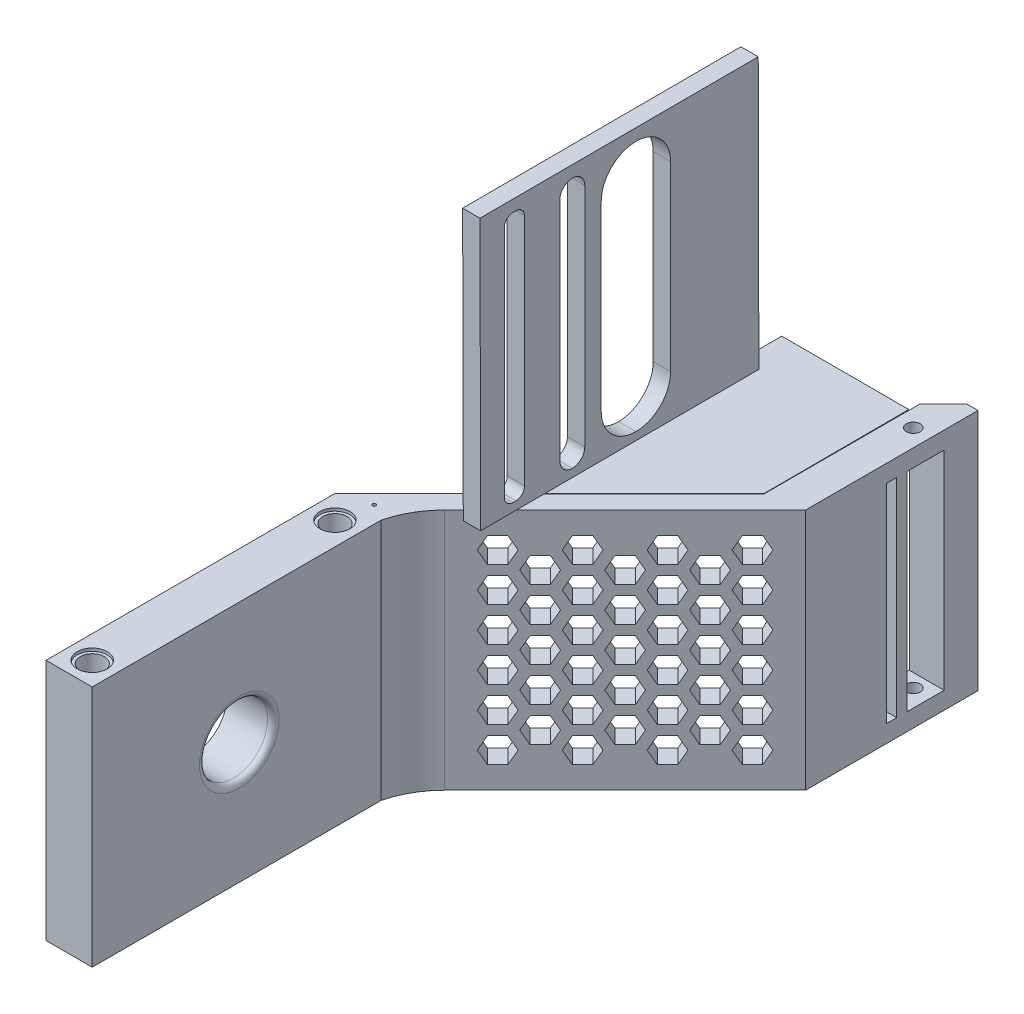
from build123d import *

# Parameters (mm, degrees)
SKETCH1_W            = 25
SKETCH1_H            = 50
SKETCH1_R            = 3.4
BOSS_EXTRUDE1_DEPTH  = 3
SKETCH2_W            = 50
SKETCH2_H            = 3
BOSS_EXTRUDE2_DEPTH  = 8
SKETCH3_W            = 8
SKETCH3_H            = 50
BOSS_EXTRUDE3_DEPTH  = 42
SKETCH4_R            = 2.65
CUT_EXTRUDE1_DEPTH   = 0.5
SKETCH5_R            = 5.888972746
CUT_EXTRUDE2_DEPTH   = 9
FILLET2_R            = 1
SKETCH6_R            = 12.6
BOSS_EXTRUDE4_DEPTH  = 2
FILLET4_R            = 1
SKETCH8_R            = 1.589780168
SKETCH8_R_2          = 1.777428262
CUT_EXTRUDE3_DEPTH   = 10
SKETCH9_W            = 49.021678163
SKETCH9_H            = 20.976854622
CUT_EXTRUDE4_DEPTH   = 68.79439129
SKETCH11_R           = 2.1
CUT_EXTRUDE5_DEPTH   = 59.480168703
SKETCH14_R           = 2.6
CUT_EXTRUDE6_DEPTH   = 0.5
BOSS_EXTRUDE5_DEPTH  = 42
FILLET5_R            = 15
BOSS_EXTRUDE6_DEPTH  = 42
SKETCH17_W           = 48.146702591
SKETCH17_H           = 46.904691646
BOSS_EXTRUDE7_DEPTH  = 3
BOSS_EXTRUDE8_DEPTH  = 2
FILL_START           = -39.593416363
FILL_PATTERN1_DEPTH  = 4.479865946
SKETCH20_W           = 3.5
SKETCH20_H           = 43.48627111
CUT_EXTRUDE7_DEPTH   = 10
FILLET6_R            = 1.5
SKETCH21_W           = 12
SKETCH21_H           = 43.48627111
CUT_EXTRUDE8_DEPTH   = 10
FILLET7_R            = 6
SKETCH23_W           = 4.3
SKETCH23_H           = 43.48627111
CUT_EXTRUDE10_DEPTH  = 10
FILLET8_R            = 2.15
SKETCH27_W           = 7.5
SKETCH27_H           = 36
CUT_EXTRUDE11_DEPTH  = 116.383052707
SKETCH28_R           = 1.2
CUT_EXTRUDE12_DEPTH  = 113.041318123
SKETCH29_W           = 6
SKETCH29_H           = 42
BOSS_EXTRUDE11_DEPTH = 5.87
CHAMFER1_SIZE        = 4
SKETCH30_R           = 0.3
CUT_EXTRUDE13_DEPTH  = 118.2394939
SKETCH31_W           = 1.8
SKETCH31_H           = 36
CUT_EXTRUDE14_DEPTH  = 10


# Read off the part's stored shape, not the designer's step: Fill Pattern1
# Some blends are built 0.0001 mm under size
with BuildPart() as part:
    # Sketch1 → Boss-Extrude1 (new body)
    with BuildSketch(Plane(origin=(0, 0, 0), x_dir=(1, 0, 0), z_dir=(0, 1, 0))):
        with Locations((2.276951673, 11.384758364)):
            Rectangle(SKETCH1_W, SKETCH1_H)
        with Locations(Location((1.276951673, 11.384758364, 0), (0, 0, 270))):
            Circle(SKETCH1_R, mode=Mode.SUBTRACT)
    extrude(amount=BOSS_EXTRUDE1_DEPTH)

    # Sketch2 → Boss-Extrude2 (add)
    with BuildSketch(Plane.ZY.offset(10.223048327)):
        with Locations((-11.384758364, 1.5)):
            Rectangle(SKETCH2_W, SKETCH2_H)
    extrude(amount=BOSS_EXTRUDE2_DEPTH)

    # Sketch3 → Boss-Extrude3 (add)
    with BuildSketch(Plane.XZ):
        with Locations((-14.223048327, -11.384758364)):
            Rectangle(SKETCH3_W, SKETCH3_H)
    extrude(amount=BOSS_EXTRUDE3_DEPTH)

    # Sketch4 → Cut-Extrude1 (cut)
    with BuildSketch(Plane(origin=(0, 3, 0), x_dir=(1, 0, 0), z_dir=(0, 1, 0))):
        with Locations(Location((-14.223048327, 32.384758364, 0), (0, 0, 270))):
            Circle(SKETCH4_R)
        with Locations(Location((-14.223048327, -9.615241636, 0), (0, 0, 270))):
            Circle(SKETCH4_R)
    cut_extrude1 = extrude(amount=-CUT_EXTRUDE1_DEPTH, mode=Mode.SUBTRACT)

    # Mirror1: Cut-Extrude1 across plane
    add(cut_extrude1.mirror(Plane.ZX.offset(-19.5)), mode=Mode.SUBTRACT)

    # Sketch5 → Cut-Extrude2 (cut)
    with BuildSketch(Plane.ZY.offset(18.223048327)):
        with Locations((-11.836279124, -21)):
            Circle(SKETCH5_R)
    extrude(amount=-CUT_EXTRUDE2_DEPTH, mode=Mode.SUBTRACT)

    # Fillet2
    fillet2_edges = [part.edges().sort_by_distance(p)[0] for p in [
        (-10.223048327, -21, -17.72525187),
    ]]
    fillet(fillet2_edges, radius=FILLET2_R)

    # Mirror2: Cut-Extrude1 across plane
    add(cut_extrude1.mirror(Plane.ZY.offset(1.723048327)), mode=Mode.SUBTRACT)

    # Sketch6 → Boss-Extrude4 (add)
    with BuildSketch(Plane(origin=(0, 3, 0), x_dir=(1, 0, 0), z_dir=(0, 1, 0))):
        with BuildLine():
            Line((14.776951673, 5.825082115), (14.776951673, 16.944434614))
            ThreePointArc((14.776951673, 16.944434614), (-13.323048327, 11.384758364), (14.776951673, 5.825082115))
        make_face()
        with Locations(Location((1.276951673, 11.384758364, 0), (0, 0, 270))):
            Circle(SKETCH6_R, mode=Mode.SUBTRACT)
    extrude(amount=BOSS_EXTRUDE4_DEPTH)

    # Fillet4
    # the kernel refuses this fillet: 1 mm, written as the material it takes off along each edge
    with BuildSketch(Plane(origin=(14.776951673, 5, -3.325082115), x_dir=(0, -1, 0), z_dir=(0, 0, -1))) as fillet4_piece_1:
        with BuildLine():
            CenterArc((FILLET4_R, FILLET4_R), FILLET4_R, 180, 90)
            Line((0, FILLET4_R), (0, 0))
            Line((0, 0), (FILLET4_R, 0))
        make_face()
    extrude(amount=16.119352499, mode=Mode.SUBTRACT)

    # Sketch8 → Cut-Extrude3 (cut)
    with BuildSketch(Plane(origin=(0, 3, 0), x_dir=(1, 0, 0), z_dir=(0, 1, 0))):
        with Locations(Location((1.276951673, 19.884758364, 0), (0, 0, 270))):
            Circle(SKETCH8_R)
        with Locations(Location((1.276951673, 2.884758364, 0), (0, 0, 270))):
            Circle(SKETCH8_R_2)
    extrude(amount=-CUT_EXTRUDE3_DEPTH, mode=Mode.SUBTRACT)

    # Sketch9 → Cut-Extrude4 (cut, through all)
    with BuildSketch(Plane.XY.offset(13.615241636)):
        with Locations((-9.733887409, 10.488427311)):
            Rectangle(SKETCH9_W, SKETCH9_H)
    extrude(amount=-CUT_EXTRUDE4_DEPTH, mode=Mode.SUBTRACT)

    # Sketch11 → Cut-Extrude5 (cut, through all)
    with BuildSketch(Plane(origin=(0, 0, 0), x_dir=(1, 0, 0), z_dir=(0, 1, 0))):
        with Locations(Location((-14.223048327, 32.384758364, 0), (0, 0, 270))):
            Circle(SKETCH11_R)
    cut_extrude5 = extrude(amount=-CUT_EXTRUDE5_DEPTH, mode=Mode.SUBTRACT)

    # Mirror3: Cut-Extrude5 across plane
    add(cut_extrude5.mirror(Plane.XY.offset(-11.384758364)), mode=Mode.SUBTRACT)

    # Sketch14 → Cut-Extrude6 (cut)
    with BuildSketch(Plane(origin=(0, 0, 0), x_dir=(1, 0, 0), z_dir=(0, 1, 0))):
        with Locations(Location((-14.223048327, -9.615241636, 0), (0, 0, 270))):
            Circle(SKETCH14_R)
    cut_extrude6 = extrude(amount=-CUT_EXTRUDE6_DEPTH, mode=Mode.SUBTRACT)

    # Mirror4: Cut-Extrude6 across plane
    add(cut_extrude6.mirror(Plane.XY.offset(-11.384758364)), mode=Mode.SUBTRACT)

    # Sketch15 → Boss-Extrude5 (add)
    with BuildSketch(Plane(origin=(0, 0, 0), x_dir=(1, 0, 0), z_dir=(0, 1, 0))):
        Polygon((-18.223048327, 36.384758364), (24.976951673, 79.584758364), (24.976951673, 74.635010896), (-13.273300859, 36.384758364), align=None)
    extrude(amount=-BOSS_EXTRUDE5_DEPTH)

    # Fillet5
    # the kernel refuses this fillet: 15 mm, written as the material it adds along each edge
    with BuildSketch(Plane(origin=(-13.273300859, 0, -36.384758364), x_dir=(1, 0, 0), z_dir=(0, -1, 0))) as fillet5_piece_1:
        with BuildLine():
            CenterArc((17.611399837, 3.601803599), FILLET5_R, 193.893637127, 31.106362873)
            Line((7.004798119, -7.004798119), (0, 0))
            Line((0, 0), (3.050252532, 0))
        make_face()
    extrude(amount=42)

    # Sketch16 → Boss-Extrude6 (add)
    with BuildSketch(Plane(origin=(0, 0, 0), x_dir=(1, 0, 0), z_dir=(0, 1, 0))):
        Polygon((18.976951673, 73.584758364), (18.976951673, 98.584758364), (24.976951673, 98.584758364), (24.976951673, 79.584758364), align=None)
    extrude(amount=-BOSS_EXTRUDE6_DEPTH)



with BuildPart() as body_2:
    # Sketch17 → Boss-Extrude7 (new body)
    with BuildSketch(Plane(origin=(-0.023048327, -88.270826713, 236.630045038), x_dir=(0, 0.002303401717977271, -0.999997347166744), z_dir=(1, 0, 0))):
        with Locations((304.295533146, 111.077940737)):
            Rectangle(SKETCH17_W, SKETCH17_H)
    extrude(amount=-BOSS_EXTRUDE7_DEPTH)


with BuildPart() as part_1:
    add(part.part)

    add(body_2.part)  # Boss-Extrude8 merges body 2
    # Sketch18 → Boss-Extrude8 (add)
    with BuildSketch(Plane(origin=(0, -0.099943314, -0.00023021), x_dir=(1, 0, 0), z_dir=(0, -0.9999973471667442, -0.0023034017179773937))):
        Polygon((-3.023048327, -91.536143969), (-3.023048327, -51.487878646), (18.976951673, -73.487820284), (18.976951673, -98.487753963), (-3.023048327, -98.487753963), align=None)
    extrude(amount=BOSS_EXTRUDE8_DEPTH)

    # Fill Pattern1 outline → Fill Pattern1 (cut)
    with BuildSketch(Plane(origin=(0, 0, 0), x_dir=(0.7071067811865457, 0, -0.7071067811865495), z_dir=(0.7071067811865493, 0, 0.7071067811865458)).offset(FILL_START)):
        Polygon((30.253964255, -6), (31.503964255, -8.165063509), (34.003964255, -8.165063509), (35.253964255, -6), (34.003964255, -3.834936491), (31.503964255, -3.834936491), align=None)
        Polygon((45.842421523, -33), (47.092421523, -35.165063509), (49.592421523, -35.165063509), (50.842421523, -33), (49.592421523, -30.834936491), (47.092421523, -30.834936491), align=None)
        Polygon((40.6462691, -24), (41.8962691, -26.165063509), (44.3962691, -26.165063509), (45.6462691, -24), (44.3962691, -21.834936491), (41.8962691, -21.834936491), align=None)
        Polygon((35.450116678, -15), (36.700116678, -17.165063509), (39.200116678, -17.165063509), (40.450116678, -15), (39.200116678, -12.834936491), (36.700116678, -12.834936491), align=None)
        Polygon((52.288573946, -8.165063509), (54.788573946, -8.165063509), (56.038573946, -6), (54.788573946, -3.834936491), (52.288573946, -3.834936491), (51.038573946, -6), align=None)
        Polygon((41.8962691, -8.165063509), (44.3962691, -8.165063509), (45.6462691, -6), (44.3962691, -3.834936491), (41.8962691, -3.834936491), (40.6462691, -6), align=None)
        Polygon((62.680878791, -8.165063509), (65.180878791, -8.165063509), (66.430878791, -6), (65.180878791, -3.834936491), (62.680878791, -3.834936491), (61.430878791, -6), align=None)
        Polygon((30.253964255, -24), (31.503964255, -26.165063509), (34.003964255, -26.165063509), (35.253964255, -24), (34.003964255, -21.834936491), (31.503964255, -21.834936491), align=None)
        Polygon((35.450116678, -33), (36.700116678, -35.165063509), (39.200116678, -35.165063509), (40.450116678, -33), (39.200116678, -30.834936491), (36.700116678, -30.834936491), align=None)
        Polygon((62.680878791, -26.165063509), (65.180878791, -26.165063509), (66.430878791, -24), (65.180878791, -21.834936491), (62.680878791, -21.834936491), (61.430878791, -24), align=None)
        Polygon((52.288573946, -26.165063509), (54.788573946, -26.165063509), (56.038573946, -24), (54.788573946, -21.834936491), (52.288573946, -21.834936491), (51.038573946, -24), align=None)
        Polygon((57.484726369, -35.165063509), (59.984726369, -35.165063509), (61.234726369, -33), (59.984726369, -30.834936491), (57.484726369, -30.834936491), (56.234726369, -33), align=None)
        Polygon((49.592421523, -17.165063509), (50.842421523, -15), (49.592421523, -12.834936491), (47.092421523, -12.834936491), (45.842421523, -15), (47.092421523, -17.165063509), align=None)
        Polygon((35.450116678, -27), (36.700116678, -29.165063509), (39.200116678, -29.165063509), (40.450116678, -27), (39.200116678, -24.834936491), (36.700116678, -24.834936491), align=None)
        Polygon((30.253964255, -18), (31.503964255, -20.165063509), (34.003964255, -20.165063509), (35.253964255, -18), (34.003964255, -15.834936491), (31.503964255, -15.834936491), align=None)
        Polygon((40.6462691, -36), (41.8962691, -38.165063509), (44.3962691, -38.165063509), (45.6462691, -36), (44.3962691, -33.834936491), (41.8962691, -33.834936491), align=None)
        Polygon((57.484726369, -29.165063509), (59.984726369, -29.165063509), (61.234726369, -27), (59.984726369, -24.834936491), (57.484726369, -24.834936491), (56.234726369, -27), align=None)
        Polygon((47.092421523, -29.165063509), (49.592421523, -29.165063509), (50.842421523, -27), (49.592421523, -24.834936491), (47.092421523, -24.834936491), (45.842421523, -27), align=None)
        Polygon((34.003964255, -38.165063509), (35.253964255, -36), (34.003964255, -33.834936491), (31.503964255, -33.834936491), (30.253964255, -36), (31.503964255, -38.165063509), align=None)
        Polygon((49.592421523, -11.165063509), (50.842421523, -9), (49.592421523, -6.834936491), (47.092421523, -6.834936491), (45.842421523, -9), (47.092421523, -11.165063509), align=None)
        Polygon((44.3962691, -20.165063509), (45.6462691, -18), (44.3962691, -15.834936491), (41.8962691, -15.834936491), (40.6462691, -18), (41.8962691, -20.165063509), align=None)
        Polygon((35.450116678, -21), (36.700116678, -23.165063509), (39.200116678, -23.165063509), (40.450116678, -21), (39.200116678, -18.834936491), (36.700116678, -18.834936491), align=None)
        Polygon((30.253964255, -12), (31.503964255, -14.165063509), (34.003964255, -14.165063509), (35.253964255, -12), (34.003964255, -9.834936491), (31.503964255, -9.834936491), align=None)
        Polygon((40.6462691, -30), (41.8962691, -32.165063509), (44.3962691, -32.165063509), (45.6462691, -30), (44.3962691, -27.834936491), (41.8962691, -27.834936491), align=None)
        Polygon((57.484726369, -23.165063509), (59.984726369, -23.165063509), (61.234726369, -21), (59.984726369, -18.834936491), (57.484726369, -18.834936491), (56.234726369, -21), align=None)
        Polygon((47.092421523, -23.165063509), (49.592421523, -23.165063509), (50.842421523, -21), (49.592421523, -18.834936491), (47.092421523, -18.834936491), (45.842421523, -21), align=None)
        Polygon((34.003964255, -32.165063509), (35.253964255, -30), (34.003964255, -27.834936491), (31.503964255, -27.834936491), (30.253964255, -30), (31.503964255, -32.165063509), align=None)
        Polygon((44.3962691, -14.165063509), (45.6462691, -12), (44.3962691, -9.834936491), (41.8962691, -9.834936491), (40.6462691, -12), (41.8962691, -14.165063509), align=None)
        Polygon((62.680878791, -32.165063509), (65.180878791, -32.165063509), (66.430878791, -30), (65.180878791, -27.834936491), (62.680878791, -27.834936491), (61.430878791, -30), align=None)
        Polygon((52.288573946, -32.165063509), (54.788573946, -32.165063509), (56.038573946, -30), (54.788573946, -27.834936491), (52.288573946, -27.834936491), (51.038573946, -30), align=None)
        Polygon((62.680878791, -38.165063509), (65.180878791, -38.165063509), (66.430878791, -36), (65.180878791, -33.834936491), (62.680878791, -33.834936491), (61.430878791, -36), align=None)
        Polygon((52.288573946, -38.165063509), (54.788573946, -38.165063509), (56.038573946, -36), (54.788573946, -33.834936491), (52.288573946, -33.834936491), (51.038573946, -36), align=None)
        Polygon((56.234726369, -15), (57.484726369, -17.165063509), (59.984726369, -17.165063509), (61.234726369, -15), (59.984726369, -12.834936491), (57.484726369, -12.834936491), align=None)
        Polygon((56.234726369, -9), (57.484726369, -11.165063509), (59.984726369, -11.165063509), (61.234726369, -9), (59.984726369, -6.834936491), (57.484726369, -6.834936491), align=None)
        Polygon((61.430878791, -18), (62.680878791, -20.165063509), (65.180878791, -20.165063509), (66.430878791, -18), (65.180878791, -15.834936491), (62.680878791, -15.834936491), align=None)
        Polygon((36.700116678, -11.165063509), (39.200116678, -11.165063509), (40.450116678, -9), (39.200116678, -6.834936491), (36.700116678, -6.834936491), (35.450116678, -9), align=None)
        Polygon((54.788573946, -20.165063509), (56.038573946, -18), (54.788573946, -15.834936491), (52.288573946, -15.834936491), (51.038573946, -18), (52.288573946, -20.165063509), align=None)
        Polygon((62.680878791, -14.165063509), (65.180878791, -14.165063509), (66.430878791, -12), (65.180878791, -9.834936491), (62.680878791, -9.834936491), (61.430878791, -12), align=None)
        Polygon((52.288573946, -14.165063509), (54.788573946, -14.165063509), (56.038573946, -12), (54.788573946, -9.834936491), (52.288573946, -9.834936491), (51.038573946, -12), align=None)
    extrude(amount=FILL_PATTERN1_DEPTH, mode=Mode.SUBTRACT)

    # Sketch20 → Cut-Extrude7 (cut)
    with BuildSketch(Plane(origin=(-0.023048327, 0, 0), x_dir=(0, 0, -1), z_dir=(1, 0, 0))):
        with Locations((49.241327098, 23.171442648)):
            Rectangle(SKETCH20_W, SKETCH20_H)
    extrude(amount=-CUT_EXTRUDE7_DEPTH, mode=Mode.SUBTRACT)

    # Fillet6
    fillet6_edges = [part_1.edges().sort_by_distance(p)[0] for p in [
        (-1.523048327, 1.428307093, -47.491327098),
        (-1.523048327, 44.914578203, -47.491327098),
        (-1.523048327, 44.914578203, -50.991327098),
        (-1.523048327, 1.428307093, -50.991327098),
    ]]
    fillet(fillet6_edges, radius=FILLET6_R)

    # Sketch21 → Cut-Extrude8 (cut)
    with BuildSketch(Plane(origin=(-0.023048327, 0, 0), x_dir=(0, 0, -1), z_dir=(1, 0, 0))):
        with Locations((70.260850303, 23.171442648)):
            Rectangle(SKETCH21_W, SKETCH21_H)
    extrude(amount=-CUT_EXTRUDE8_DEPTH, mode=Mode.SUBTRACT)

    # Fillet7
    fillet7_edges = [part_1.edges().sort_by_distance(p)[0] for p in [
        (-1.523048327, 1.428307093, -76.260850303),
        (-1.523048327, 1.428307093, -64.260850303),
        (-1.523048327, 44.914578203, -64.260850303),
        (-1.523048327, 44.914578203, -76.260850303),
    ]]
    fillet(fillet7_edges, radius=FILLET7_R - 0.0001)  # a hair under: the kernel refuses the full size

    # Sketch23 → Cut-Extrude10 (cut)
    with BuildSketch(Plane(origin=(-0.023048327, 0, 0), x_dir=(0, 0, -1), z_dir=(1, 0, 0))):
        with Locations((59.260879484, 23.171442648)):
            Rectangle(SKETCH23_W, SKETCH23_H)
    extrude(amount=-CUT_EXTRUDE10_DEPTH, mode=Mode.SUBTRACT)

    # Fillet8
    fillet8_edges = [part_1.edges().sort_by_distance(p)[0] for p in [
        (-1.523048327, 1.428307093, -57.110879484),
        (-1.523048327, 1.428307093, -61.410879484),
        (-1.523048327, 44.914578203, -57.110879484),
        (-1.523048327, 44.914578203, -61.410879484),
    ]]
    fillet(fillet8_edges, radius=FILLET8_R - 0.0001)  # a hair under: the kernel refuses the full size

    # Sketch27 → Cut-Extrude11 (cut, through all)
    with BuildSketch(Plane.ZY.offset(-18.976951673)):
        with Locations((-97.706609658, -21)):
            Rectangle(SKETCH27_W, SKETCH27_H)
    extrude(amount=-CUT_EXTRUDE11_DEPTH, mode=Mode.SUBTRACT)

    # Sketch28 → Cut-Extrude12 (cut, through all)
    with BuildSketch(Plane(origin=(0, 0, 0), x_dir=(1, 0, 0), z_dir=(0, 1, 0))):
        with Locations(Location((21.976951673, 96.270684011, 0), (0, 0, 270))):
            Circle(SKETCH28_R)
    extrude(amount=-CUT_EXTRUDE12_DEPTH, mode=Mode.SUBTRACT)

    # Sketch29 → Boss-Extrude11 (add)
    with BuildSketch(Plane(origin=(0, 0, -98.584758364), x_dir=(-1, 0, 0), z_dir=(0, 0, -1))):
        with Locations((-21.976951673, -21)):
            Rectangle(SKETCH29_W, SKETCH29_H)
    extrude(amount=BOSS_EXTRUDE11_DEPTH)

    # Chamfer1
    chamfer1_edges = [part_1.edges().sort_by_distance(p)[0] for p in [
        (18.976951673, -21, -104.454758364),
    ]]
    chamfer(chamfer1_edges, length=CHAMFER1_SIZE)

    # Sketch30 → Cut-Extrude13 (cut, through all)
    with BuildSketch(Plane(origin=(0, 0, 0), x_dir=(1, 0, 0), z_dir=(0, 1, 0))):
        with Locations(Location((-13.114758504, 38.068023801, 0), (0, 0, 270))):
            Circle(SKETCH30_R)
    extrude(amount=-CUT_EXTRUDE13_DEPTH, mode=Mode.SUBTRACT)

    # Sketch31 → Cut-Extrude14 (cut)
    with BuildSketch(Plane(origin=(24.976951673, 0, 0), x_dir=(0, 0, -1), z_dir=(1, 0, 0))):
        with Locations((93.056609658, -21)):
            Rectangle(SKETCH31_W, SKETCH31_H)
        with Locations((89.484758364, -21)):
            Rectangle(SKETCH31_W, SKETCH31_H)
    extrude(amount=-CUT_EXTRUDE14_DEPTH, mode=Mode.SUBTRACT)


solid = part_1.part
